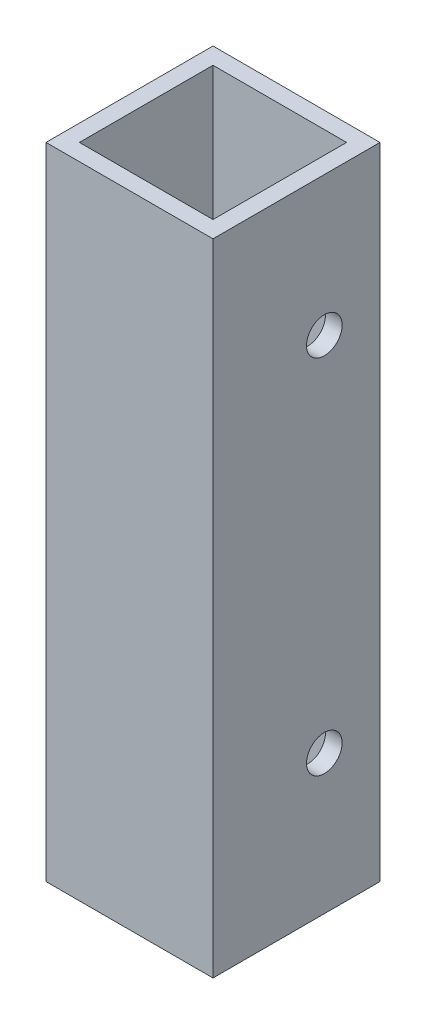
from build123d import *

# Parameters (mm, degrees)
SKETCH_1_W              = 15
SKETCH_1_H              = 15
SKETCH_1_W_2            = 12
SKETCH_1_H_2            = 12
EXTRUDE_1_DEPTH         = 57.5
CUT_EXTRUDE_1_OUTLINE_R = 1.6
CUT_EXTRUDE_1_DEPTH     = 15


# Read off the part's stored shape, not the designer's step: 切除-拉伸1
with BuildPart() as part:
    # 草图1 → 凸台-拉伸1 (new body)
    with BuildSketch(Plane(origin=(0, 0, 0), x_dir=(1, 0, 0), z_dir=(0, 1, 0))):
        with Locations((7.5, 7.5)):
            Rectangle(SKETCH_1_W, SKETCH_1_H)
        with Locations((7.5, 7.5)):
            Rectangle(SKETCH_1_W_2, SKETCH_1_H_2, mode=Mode.SUBTRACT)
    extrude(amount=EXTRUDE_1_DEPTH)

    # 切除-拉伸1 outline → 切除-拉伸1 (cut)
    with BuildSketch(Plane.YZ):
        with Locations((45, -10)):
            Circle(CUT_EXTRUDE_1_OUTLINE_R)
        with Locations((12.5, -10)):
            Circle(CUT_EXTRUDE_1_OUTLINE_R)
    extrude(amount=CUT_EXTRUDE_1_DEPTH, mode=Mode.SUBTRACT)


solid = part.part
